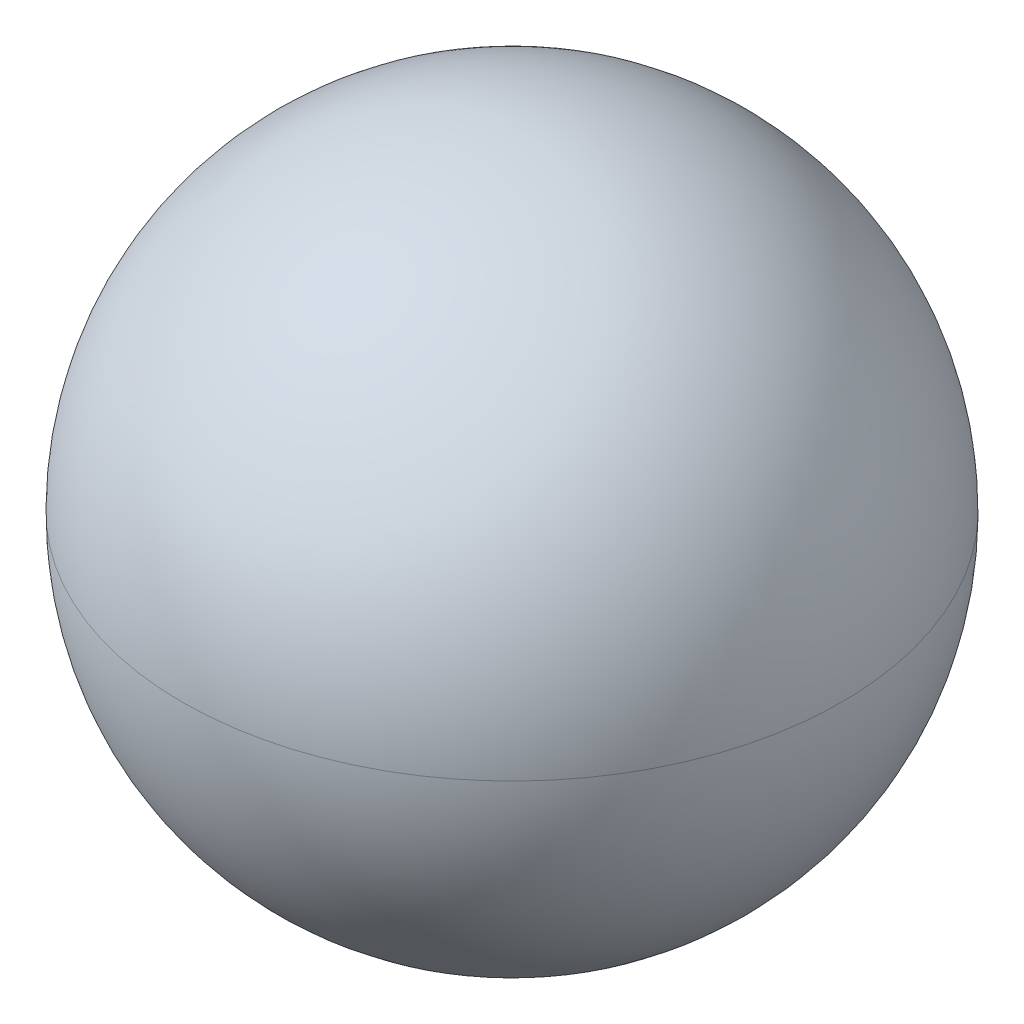
from build123d import *

# Parameters (mm, degrees)
SKETCH1_R           = 88.9
BOSS_EXTRUDE1_DEPTH = 177.8
FILLET1_R           = 88.9
FILLET2_R           = 88.9


with BuildPart() as part:
    # Sketch1 → Boss-Extrude1 (new body)
    with BuildSketch(Plane(origin=(0, 0, 0), x_dir=(1, 0, 0), z_dir=(0, 1, 0))):
        with Locations(Location((0, 0, 0), (0, 0, 270))):
            Circle(SKETCH1_R)
    extrude(amount=BOSS_EXTRUDE1_DEPTH)

    # Fillet1
    fillet1_edges = [part.edges().sort_by_distance(p)[0] for p in [
        (0, 177.8, -88.9),
    ]]
    fillet(fillet1_edges, radius=FILLET1_R)

    # Fillet2
    fillet2_edges = [part.edges().sort_by_distance(p)[0] for p in [
        (0, 0, -88.9),
    ]]
    fillet(fillet2_edges, radius=FILLET2_R - 0.0001)  # a hair under: the kernel refuses the full size


solid = part.part
